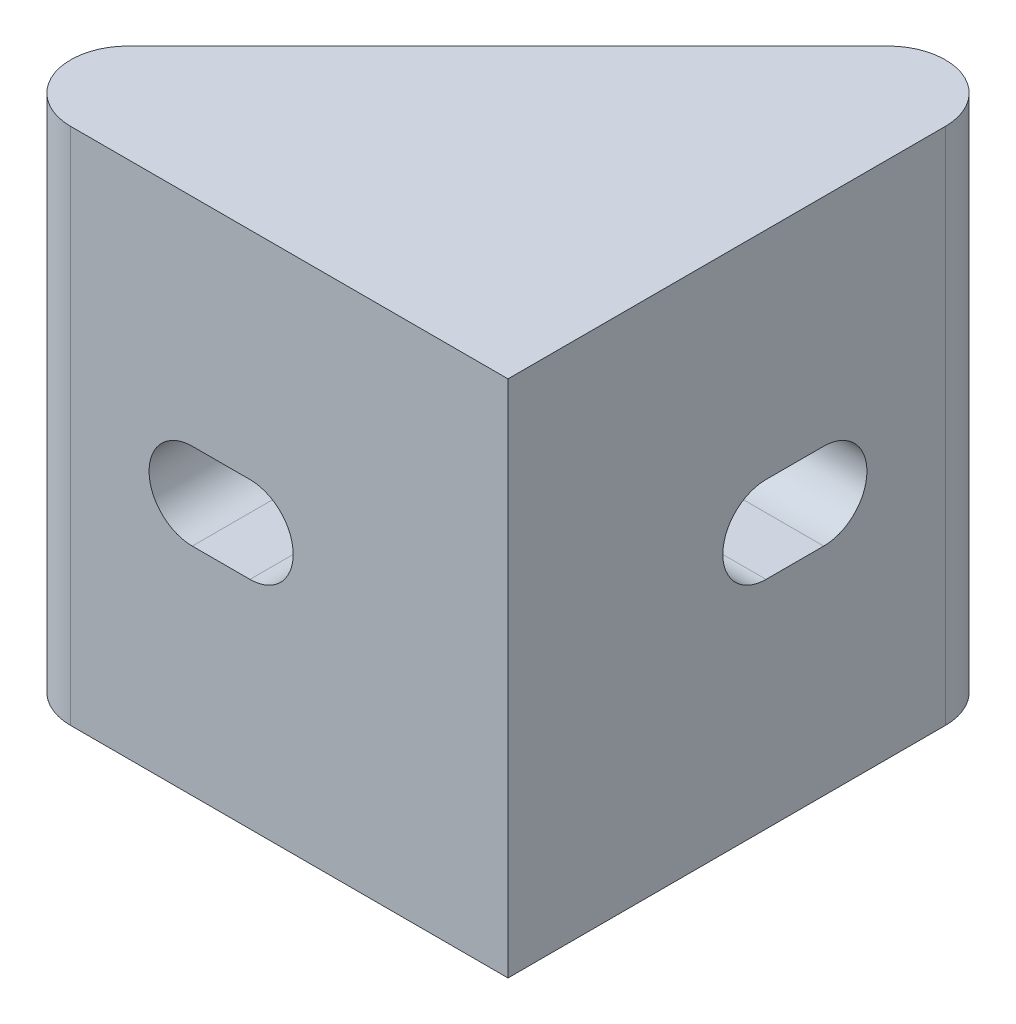
from build123d import *

# Parameters (mm, degrees)
DODANIE_WYCI_GNI_CIE1_DEPTH = 18
SKORUPA1_START              = 2
SKORUPA1_DEPTH              = 14
DODANIE_WYCI_GNI_CIE2_DEPTH = 18
WYTNIJ_WYCI_GNI_CIE1_REACH  = 32.228
WYTNIJ_WYCI_GNI_CIE2_REACH  = 32.228


# Read off the part's stored shape, not the designer's step: Skorupa1
with BuildPart() as part:
    # Szkic1 → Dodanie-wyciągnięcie1 (new body)
    with BuildSketch(Plane(origin=(0, 0, 0), x_dir=(1, 0, 0), z_dir=(0, 1, 0))):
        with BuildLine():
            Line((-15.171572875, 0), (0, 0))
            Line((0, 0), (0, 15.171572875))
            ThreePointArc((0, 15.171572875), (-1, 16.903623683), (-3, 16.903623683))
            Line((-3, 16.903623683), (-3, 3))
            Line((-3, 3), (-16.903623683, 3))
            ThreePointArc((-16.903623683, 3), (-16.903623683, 1), (-15.171572875, 0))
        make_face()
        with BuildLine():
            ThreePointArc((-16.585786438, 3.414213562), (-16.758279556, 3.217522858), (-16.903623683, 3))
            Line((-16.903623683, 3), (-3, 3))
            Line((-3, 3), (-3, 16.903623683))
            ThreePointArc((-3, 16.903623683), (-3.217522858, 16.758279556), (-3.414213562, 16.585786438))
            Line((-3.414213562, 16.585786438), (-16.585786438, 3.414213562))
        make_face()
    extrude(amount=DODANIE_WYCI_GNI_CIE1_DEPTH)

    # Skorupa1 outline → Skorupa1 (cut)
    with BuildSketch(Plane(origin=(0, 0, 0), x_dir=(1, 0, 0), z_dir=(0, 1, 0)).offset(SKORUPA1_START)):
        with BuildLine():
            Line((-3, 3), (-3, 15.171572875))
            Line((-3, 15.171572875), (0, 15.171572875))
            ThreePointArc((0, 15.171572875), (-1.234633135, 17.01933194), (-3.414213562, 16.585786438))
            Line((-3.414213562, 16.585786438), (-16.585786438, 3.414213562))
            ThreePointArc((-16.585786438, 3.414213562), (-17.01933194, 1.234633135), (-15.171572875, 0))
            Line((-15.171572875, 0), (-15.171572875, 3))
            Line((-15.171572875, 3), (-3, 3))
        make_face()
    extrude(amount=SKORUPA1_DEPTH, mode=Mode.SUBTRACT)

    # Szkic1<3> → Dodanie-wyciągnięcie2 (add)
    with BuildSketch(Plane(origin=(0, 0, 0), x_dir=(1, 0, 0), z_dir=(0, 1, 0))):
        with BuildLine():
            Line((-15.171572875, 0), (0, 0))
            Line((0, 0), (0, 15.171572875))
            ThreePointArc((0, 15.171572875), (-1, 16.903623683), (-3, 16.903623683))
            Line((-3, 16.903623683), (-3, 3))
            Line((-3, 3), (-16.903623683, 3))
            ThreePointArc((-16.903623683, 3), (-16.903623683, 1), (-15.171572875, 0))
        make_face()
    extrude(amount=DODANIE_WYCI_GNI_CIE2_DEPTH)

    # Szkic3 → Wytnij-wyciągnięcie1 (cut, up to next)
    with BuildSketch(Plane.XY, mode=Mode.PRIVATE) as wytnij_wyci_gni_cie1_sk1:
        with BuildLine():
            Line((-8.951811841, 7.5), (-10.951811841, 7.5))
            ThreePointArc((-10.951811841, 7.5), (-12.451811841, 9), (-10.951811841, 10.5))
            Line((-10.951811841, 10.5), (-8.951811841, 10.5))
            ThreePointArc((-8.951811841, 10.5), (-7.451811841, 9), (-8.951811841, 7.5))
        make_face()
    wytnij_wyci_gni_cie1_tool1 = extrude(wytnij_wyci_gni_cie1_sk1.sketch, amount=-WYTNIJ_WYCI_GNI_CIE1_REACH, mode=Mode.PRIVATE) & part.part
    add(wytnij_wyci_gni_cie1_tool1.solids().sort_by_distance((-9.951812, 9, 0))[0], mode=Mode.SUBTRACT)

    # Szkic4 → Wytnij-wyciągnięcie2 (cut, up to next)
    with BuildSketch(Plane(origin=(0, 0, 0), x_dir=(0, 0, -1), z_dir=(1, 0, 0)), mode=Mode.PRIVATE) as wytnij_wyci_gni_cie2_sk1:
        with BuildLine():
            Line((10.951811841, 7.5), (8.951811841, 7.5))
            ThreePointArc((8.951811841, 7.5), (7.451811841, 9), (8.951811841, 10.5))
            Line((8.951811841, 10.5), (10.951811841, 10.5))
            ThreePointArc((10.951811841, 10.5), (12.451811841, 9), (10.951811841, 7.5))
        make_face()
    wytnij_wyci_gni_cie2_tool1 = extrude(wytnij_wyci_gni_cie2_sk1.sketch, amount=-WYTNIJ_WYCI_GNI_CIE2_REACH, mode=Mode.PRIVATE) & part.part
    add(wytnij_wyci_gni_cie2_tool1.solids().sort_by_distance((0, 9, -9.951812))[0], mode=Mode.SUBTRACT)


solid = part.part
